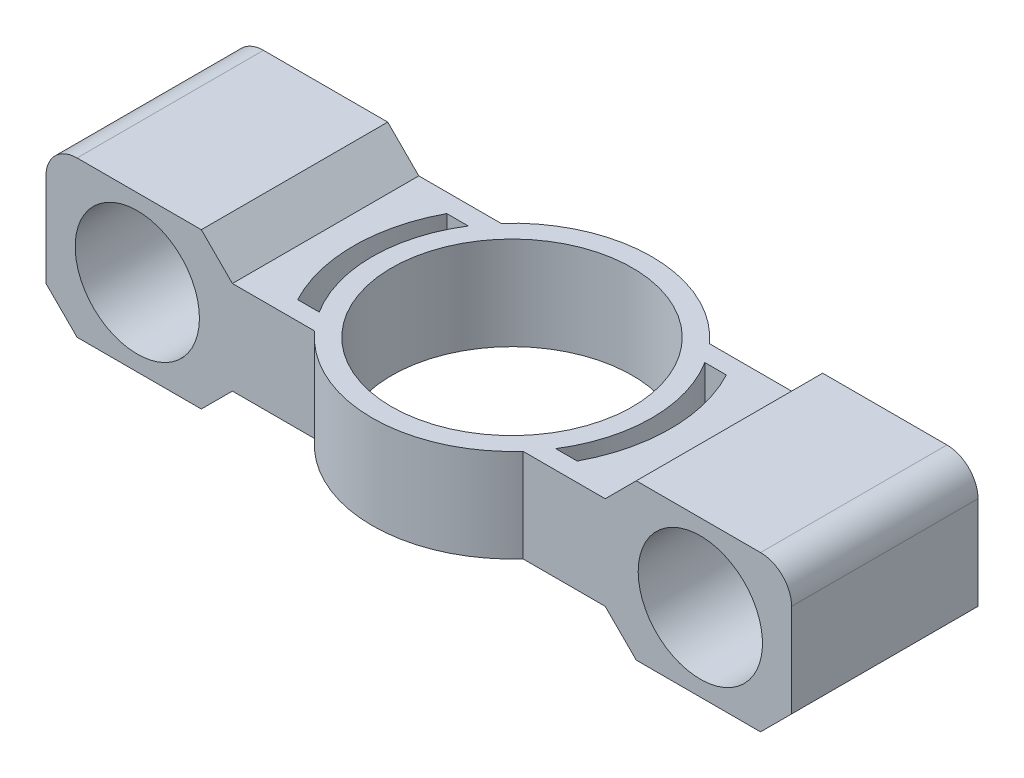
from build123d import *

# Parameters (mm, degrees)
SKETCH1_W             = 36
SKETCH1_H             = 36
BOSS_EXTRUDE3_DEPTH   = 15
BOSS_EXTRUDE3_2_DEPTH = 15
SKETCH1_6_R           = 23.25
BOSS_EXTRUDE4_DEPTH   = 9
CHAMFER3_SIZE         = 6
FILLET1_R             = 6
SKETCH2_R             = 6.5
CUT_EXTRUDE2_DEPTH    = 64.5
SKETCH2_4_R           = 12
SKETCH2_4_R_2         = 6.5
CUT_EXTRUDE3_DEPTH    = 19.5
CUT_EXTRUDE5_START    = -7.5
SKETCH4_R             = 12
SKETCH4_R_2           = 6.5
CUT_EXTRUDE5_DEPTH    = 87


with BuildPart() as part:
    # Sketch1 → Boss-Extrude3 (new, symmetric)
    with BuildSketch(Plane(origin=(0, 0, 0), x_dir=(1, 0, 0), z_dir=(0, 1, 0))):
        with Locations((-54, 0)):
            Rectangle(SKETCH1_W, SKETCH1_H)
    extrude(amount=BOSS_EXTRUDE3_DEPTH, both=True)



with BuildPart() as body_2:
    # Sketch1 → Boss-Extrude3 2 (new, symmetric)
    with BuildSketch(Plane(origin=(0, 0, 0), x_dir=(1, 0, 0), z_dir=(0, 1, 0))):
        with Locations((54, 0)):
            Rectangle(SKETCH1_W, SKETCH1_H)
    extrude(amount=BOSS_EXTRUDE3_2_DEPTH, both=True)


with BuildPart() as part_1:
    add(part.part)

    add(body_2.part)  # Boss-Extrude4 merges body 2
    # Sketch1<6> → Boss-Extrude4 (add, symmetric)
    with BuildSketch(Plane(origin=(0, 0, 0), x_dir=(1, 0, 0), z_dir=(0, 1, 0))):
        with BuildLine():
            Line((-72, -18), (-20.124611797, -18))
            ThreePointArc((-20.124611797, -18), (0, -27), (20.124611797, -18))
            Line((20.124611797, -18), (72, -18))
            Line((72, -18), (72, 18))
            Line((72, 18), (20.124611797, 18))
            ThreePointArc((20.124611797, 18), (0, 27), (-20.124611797, 18))
            Line((-20.124611797, 18), (-72, 18))
            Line((-72, 18), (-72, -18))
        make_face()
        with Locations(Location((0, 0, 0), (0, 0, 270))):
            Circle(SKETCH1_6_R, mode=Mode.SUBTRACT)
        with BuildLine():
            Line((22.839439573, 14.4), (27, 14.4))
            ThreePointArc((27, 14.4), (30.6, 0), (27, -14.4))
            Line((27, -14.4), (22.839439573, -14.4))
            ThreePointArc((22.839439573, -14.4), (27, 0), (22.839439573, 14.4))
        make_face(mode=Mode.SUBTRACT)
        with BuildLine():
            Line((-27, 14.4), (-22.839439573, 14.4))
            ThreePointArc((-22.839439573, 14.4), (-27, 0), (-22.839439573, -14.4))
            Line((-22.839439573, -14.4), (-27, -14.4))
            ThreePointArc((-27, -14.4), (-30.6, 0), (-27, 14.4))
        make_face(mode=Mode.SUBTRACT)
    extrude(amount=BOSS_EXTRUDE4_DEPTH, both=True)

    # Chamfer3
    chamfer3_edges = [part_1.edges().sort_by_distance(p)[0] for p in [
        (36, 15, 0),
        (72, -15, 0),
        (36, -15, 0),
        (-36, -15, 0),
        (-72, -15, 0),
        (-36, 15, 0),
    ]]
    chamfer(chamfer3_edges, length=CHAMFER3_SIZE - 0.0001)  # a hair under: the kernel refuses the full size

    # Fillet1
    fillet1_edges = [part_1.edges().sort_by_distance(p)[0] for p in [
        (-72, 15, 0),
        (72, 15, 0),
    ]]
    fillet(fillet1_edges, radius=FILLET1_R)

    # Sketch2 → Cut-Extrude2 (cut)
    with BuildSketch(Plane.XY.offset(18)):
        with Locations((-54.369879574, 0)):
            Circle(SKETCH2_R)
        with Locations((54.369879574, 0)):
            Circle(SKETCH2_R)
    extrude(amount=-CUT_EXTRUDE2_DEPTH, mode=Mode.SUBTRACT)

    # Sketch2<4> → Cut-Extrude3 (cut)
    # profile 1 of 2: a face of its own
    with BuildSketch(Plane.XY.offset(18)):
        with Locations((-54.369879574, 0)):
            Circle(SKETCH2_4_R)
        with Locations((-54.369879574, 0)):
            Circle(SKETCH2_4_R_2, mode=Mode.SUBTRACT)
    # profile 2 of 2: a face of its own
    with BuildSketch(Plane.XY.offset(18)):
        with Locations(Location((54.369879574, 0, 0), (0, 0, 180))):
            Circle(SKETCH2_4_R)
        with Locations((54.369879574, 0)):
            Circle(SKETCH2_4_R_2, mode=Mode.SUBTRACT)
    extrude(amount=-CUT_EXTRUDE3_DEPTH, mode=Mode.SUBTRACT)

    # Sketch4 → Cut-Extrude5 (cut)
    # profile 1 of 2: a face of its own
    with BuildSketch(Plane.XY.offset(-1.5).offset(CUT_EXTRUDE5_START)):
        with Locations(Location((54.369879574, 0, 0), (0, 0, 180))):
            Circle(SKETCH4_R)
        with Locations((54.369879574, 0)):
            Circle(SKETCH4_R_2, mode=Mode.SUBTRACT)
    # profile 2 of 2: a face of its own
    with BuildSketch(Plane.XY.offset(-1.5).offset(CUT_EXTRUDE5_START)):
        with Locations((-54.369879574, 0)):
            Circle(SKETCH4_R)
        with Locations((-54.369879574, 0)):
            Circle(SKETCH4_R_2, mode=Mode.SUBTRACT)
    extrude(amount=-CUT_EXTRUDE5_DEPTH, mode=Mode.SUBTRACT)


solid = part_1.part
